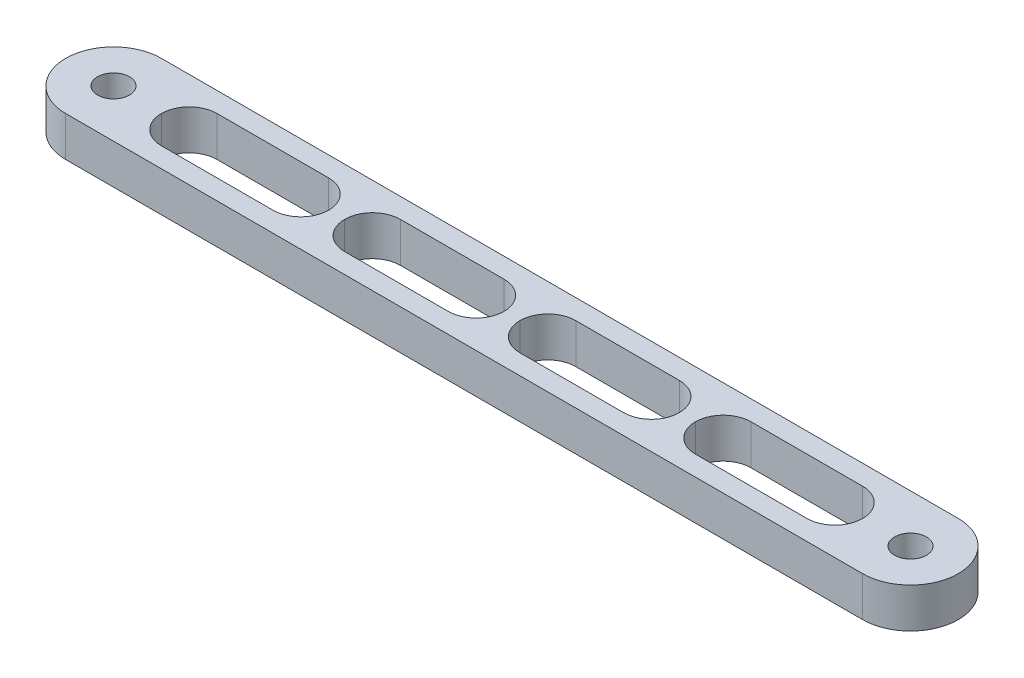
from build123d import *

# Parameters (mm, degrees)
SKETCH1_R           = 4
SKETCH1_W           = 42
SKETCH1_H           = 14
SKETCH1_W_2         = 40
BOSS_EXTRUDE1_DEPTH = 10
FILLET1_R           = 7


with BuildPart() as part:
    # Sketch1 → Boss-Extrude1 (new body)
    with BuildSketch(Plane(origin=(0, 0, 0), x_dir=(1, 0, 0), z_dir=(0, 1, 0))):
        with BuildLine():
            Line((-200, 12), (0, 12))
            ThreePointArc((0, 12), (12, 0), (0, -12))
            Line((0, -12), (-200, -12))
            ThreePointArc((-200, -12), (-205.477225575, -10.677078252), (-209.746794345, -7))
            ThreePointArc((-209.746794345, -7), (-212, 0), (-209.746794345, 7))
            ThreePointArc((-209.746794345, 7), (-205.477225575, 10.677078252), (-200, 12))
        make_face()
        with Locations(Location((-200, 0, 0), (0, 0, 270))):
            Circle(SKETCH1_R, mode=Mode.SUBTRACT)
        with Locations(Location((0, 0, 0), (0, 0, 270))):
            Circle(SKETCH1_R, mode=Mode.SUBTRACT)
        with Locations((-167, 0)):
            Rectangle(SKETCH1_W, SKETCH1_H, mode=Mode.SUBTRACT)
        with Locations((-122, 0)):
            Rectangle(SKETCH1_W_2, SKETCH1_H, mode=Mode.SUBTRACT)
        with Locations((-78, 0)):
            Rectangle(SKETCH1_W_2, SKETCH1_H, mode=Mode.SUBTRACT)
        with Locations((-33, 0)):
            Rectangle(SKETCH1_W, SKETCH1_H, mode=Mode.SUBTRACT)
    extrude(amount=BOSS_EXTRUDE1_DEPTH)

    # Fillet1
    fillet1_edges = [part.edges().sort_by_distance(p)[0] for p in [
        (-142, 5, -7),
        (-98, 5, -7),
        (-54, 5, -7),
        (-58, 5, -7),
        (-12, 5, -7),
        (-102, 5, -7),
        (-146, 5, -7),
        (-146, 5, 7),
        (-102, 5, 7),
        (-58, 5, 7),
        (-12, 5, 7),
        (-54, 5, 7),
        (-98, 5, 7),
        (-142, 5, 7),
        (-188, 5, 7),
        (-188, 5, -7),
    ]]
    fillet(fillet1_edges, radius=FILLET1_R - 0.0001)  # a hair under: the kernel refuses the full size


solid = part.part
